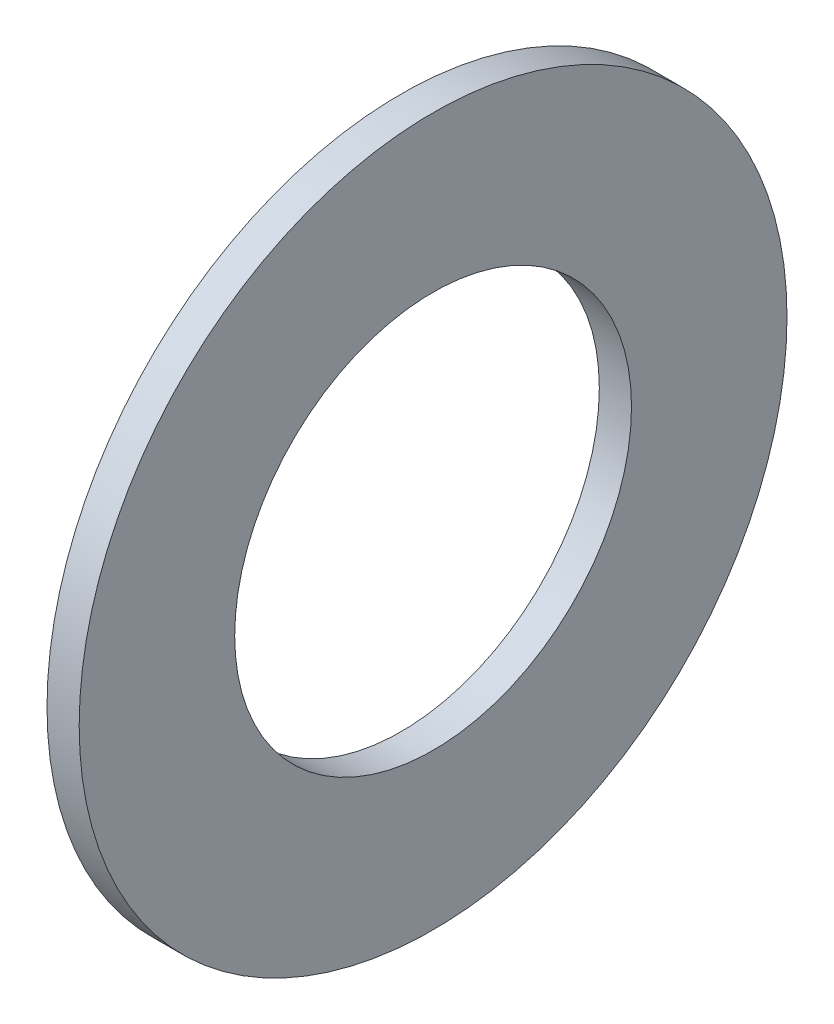
from build123d import *

# Parameters (mm, degrees)
SKETCH1_W = 3
SKETCH1_H = 14.5


with BuildPart() as part:
    # Sketch1 → Base-Revolve (revolve)
    with BuildSketch(Plane.XY):
        with Locations((-1.5, 25.75)):
            Rectangle(SKETCH1_W, SKETCH1_H)
    revolve(axis=Axis((-34.925, 0, 0), (1, 0, 0)))


solid = part.part
